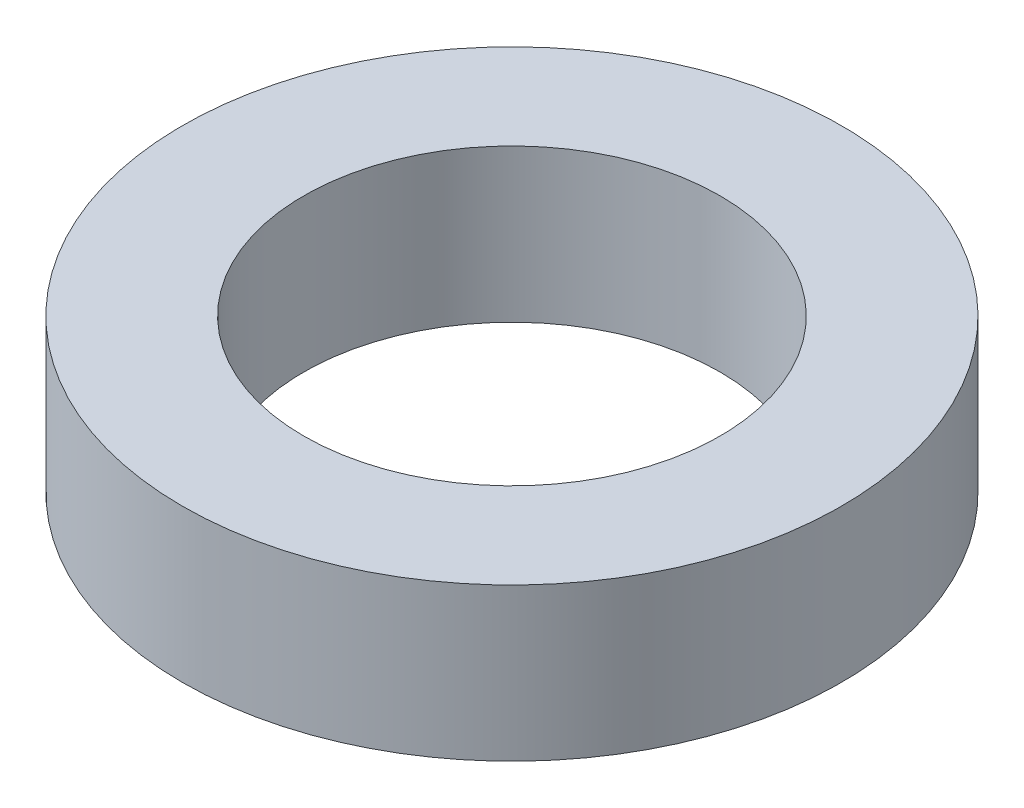
from build123d import *

# Parameters (mm, degrees)
SKETCH1_R           = 47.5
BOSS_EXTRUDE1_DEPTH = 22
SKETCH2_R           = 30
CUT_EXTRUDE1_DEPTH  = 71.685925049


with BuildPart() as part:
    # Sketch1 → Boss-Extrude1 (new body)
    with BuildSketch(Plane(origin=(0, 0, 0), x_dir=(1, 0, 0), z_dir=(0, 1, 0))):
        Circle(SKETCH1_R)
    extrude(amount=BOSS_EXTRUDE1_DEPTH)

    # Sketch2 → Cut-Extrude1 (cut, through all)
    with BuildSketch(Plane(origin=(0, 0, 0), x_dir=(1, 0, 0), z_dir=(0, 1, 0))):
        Circle(SKETCH2_R)
    extrude(amount=CUT_EXTRUDE1_DEPTH, mode=Mode.SUBTRACT)


solid = part.part
